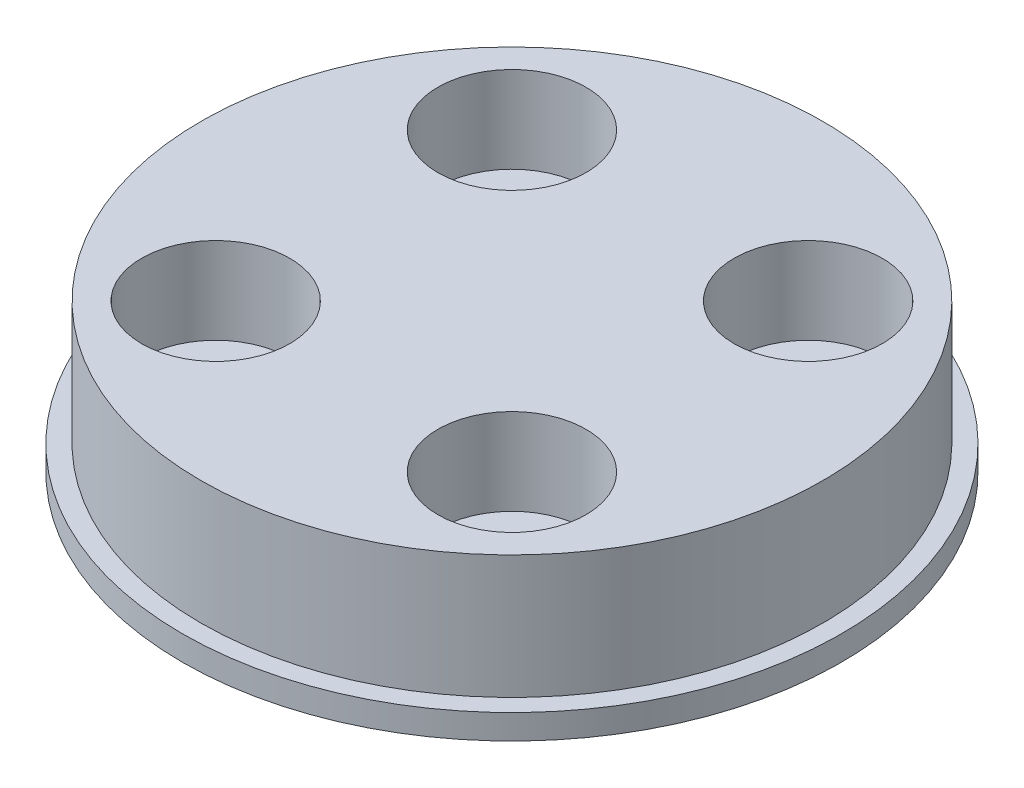
from build123d import *

# Parameters (mm, degrees)
SKETCH1_R           = 13.35
SKETCH1_R_2         = 1.575
BOSS_EXTRUDE1_DEPTH = 1
SKETCH1_3_R         = 12.6
SKETCH1_3_R_2       = 1.575
BOSS_EXTRUDE2_DEPTH = 6
SKETCH2_R           = 3
CUT_EXTRUDE1_DEPTH  = 3.5


with BuildPart() as part:
    # Sketch1 → Boss-Extrude1 (new body)
    with BuildSketch(Plane(origin=(0, 33, 0), x_dir=(1, 0, 0), z_dir=(0, 1, 0))):
        Circle(SKETCH1_R)
        with Locations((-6, -6)):
            Circle(SKETCH1_R_2, mode=Mode.SUBTRACT)
        with Locations((6, -6)):
            Circle(SKETCH1_R_2, mode=Mode.SUBTRACT)
        with Locations((-6, 6)):
            Circle(SKETCH1_R_2, mode=Mode.SUBTRACT)
        with Locations((6, 6)):
            Circle(SKETCH1_R_2, mode=Mode.SUBTRACT)
    extrude(amount=BOSS_EXTRUDE1_DEPTH)

    # Sketch1<3> → Boss-Extrude2 (add)
    with BuildSketch(Plane(origin=(0, 33, 0), x_dir=(1, 0, 0), z_dir=(0, 1, 0))):
        Circle(SKETCH1_3_R)
        with Locations((-6, -6)):
            Circle(SKETCH1_3_R_2, mode=Mode.SUBTRACT)
        with Locations((6, -6)):
            Circle(SKETCH1_3_R_2, mode=Mode.SUBTRACT)
        with Locations((-6, 6)):
            Circle(SKETCH1_3_R_2, mode=Mode.SUBTRACT)
        with Locations((6, 6)):
            Circle(SKETCH1_3_R_2, mode=Mode.SUBTRACT)
    extrude(amount=BOSS_EXTRUDE2_DEPTH)

    # Sketch2 → Cut-Extrude1 (cut)
    with BuildSketch(Plane(origin=(0, 39, 0), x_dir=(1, 0, 0), z_dir=(0, 1, 0))):
        with Locations((-6, 6)):
            Circle(SKETCH2_R)
        with Locations((6, 6)):
            Circle(SKETCH2_R)
        with Locations((6, -6)):
            Circle(SKETCH2_R)
        with Locations((-6, -6)):
            Circle(SKETCH2_R)
    extrude(amount=-CUT_EXTRUDE1_DEPTH, mode=Mode.SUBTRACT)


solid = part.part
